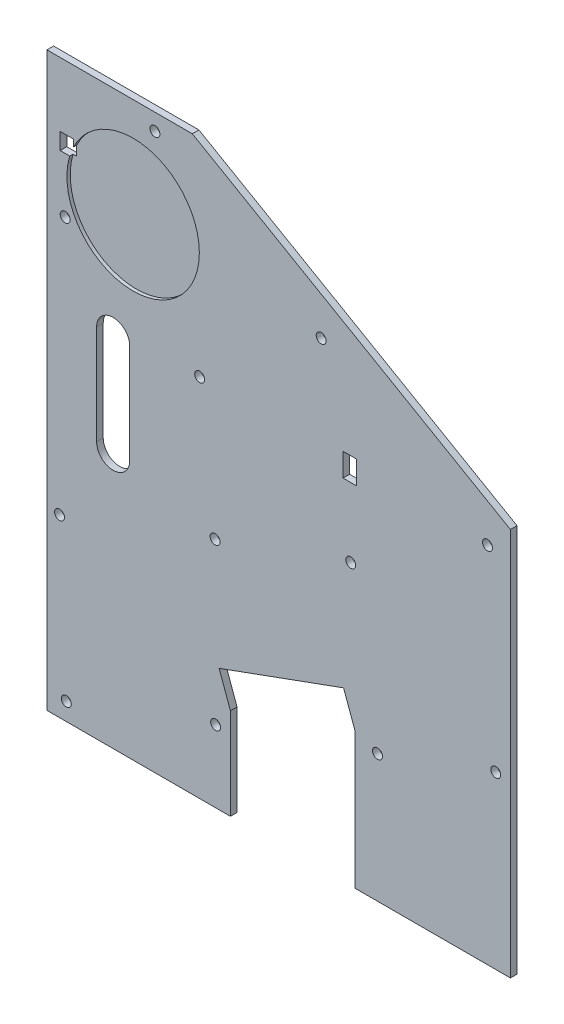
from build123d import *

# Parameters (mm, degrees)
BOSS_EXTRUDE1_DEPTH         = 2
SKETCH3_W                   = 4
SKETCH3_H                   = 5
SKETCH3_W_2                 = 4.004504799
SKETCH3_H_2                 = 7.007808652
CUT_EXTRUDE1_DEPTH          = 10
SKETCH4_R                   = 20
CUT_EXTRUDE2_DEPTH          = 1
F_3_0MM_PRESS_DOWEL_HOLE1_D = 3
CUT_EXTRUDE3_DEPTH          = 272.480461976


with BuildPart() as part:
    # Sketch1 → Boss-Extrude1 (new body)
    with BuildSketch(Plane.XY):
        Polygon((-70, 100), (-70, -72.799540117), (70, -72.799540117), (70, 44.524791386), (-26.08587988, 100), align=None)
    extrude(amount=BOSS_EXTRUDE1_DEPTH)

    # Sketch3 → Cut-Extrude1 (cut)
    with BuildSketch(Plane.XY.offset(2)):
        Polygon((19.595167527, -22.106795815), (-17.992537304, -35.787601548), (-14.572335871, -45.184527756), (-14.572335871, -75.184527756), (23.015368961, -75.184527756), (23.015368961, -31.503722023), align=None)
        with Locations((-64, 78.155444566)):
            Rectangle(SKETCH3_W, SKETCH3_H)
        with Locations((21.429491924, 36.193920339)):
            Rectangle(SKETCH3_W_2, SKETCH3_H_2)
    extrude(amount=-CUT_EXTRUDE1_DEPTH, mode=Mode.SUBTRACT)

    # Sketch4 → Cut-Extrude2 (cut)
    with BuildSketch(Plane.XY.offset(2)):
        with Locations((-43.968804066, 69.910192249)):
            Circle(SKETCH4_R)
    extrude(amount=-CUT_EXTRUDE2_DEPTH, mode=Mode.SUBTRACT)

    # Ø3.0mm Press Dowel Hole1 (through all)
    with Locations(Plane(origin=(-89.742029537, -119.499715795, 0), x_dir=(-1, 0, 0), z_dir=(0, 0, -1))):
        with Locations((-23.542258378, 99.781049413), (-25.594379238, 52.014538143), (-70.699625036, 68.431505023), (-70.526889417, 116.882056579), (-111.491838386, 131.259989766), (-119.586439667, 85.314281565), (-155.294759257, 98.311047011), (-152.806439447, 156.481766603), (-65.878236217, 157.017664987), (-102.576966028, 185.481766603), (-52.347492608, 214.481766603), (-25.242029537, 178.499715795)):
            Hole(F_3_0MM_PRESS_DOWEL_HOLE1_D / 2)

    # Sketch7 → Cut-Extrude3 (cut, through all)
    with BuildSketch(Plane(origin=(-89.742029537, -119.499715795, 2), x_dir=(1, 0, 0), z_dir=(0, 0, 1))):
        with BuildLine():
            Line((44.742029537, 154.499715795), (44.742029537, 124.499715795))
            ThreePointArc((44.742029537, 124.499715795), (39.742029537, 119.499715795), (34.742029537, 124.499715795))
            Line((34.742029537, 124.499715795), (34.742029537, 154.499715795))
            ThreePointArc((34.742029537, 154.499715795), (39.742029537, 159.499715795), (44.742029537, 154.499715795))
        make_face()
    extrude(amount=-CUT_EXTRUDE3_DEPTH, mode=Mode.SUBTRACT)


solid = part.part
